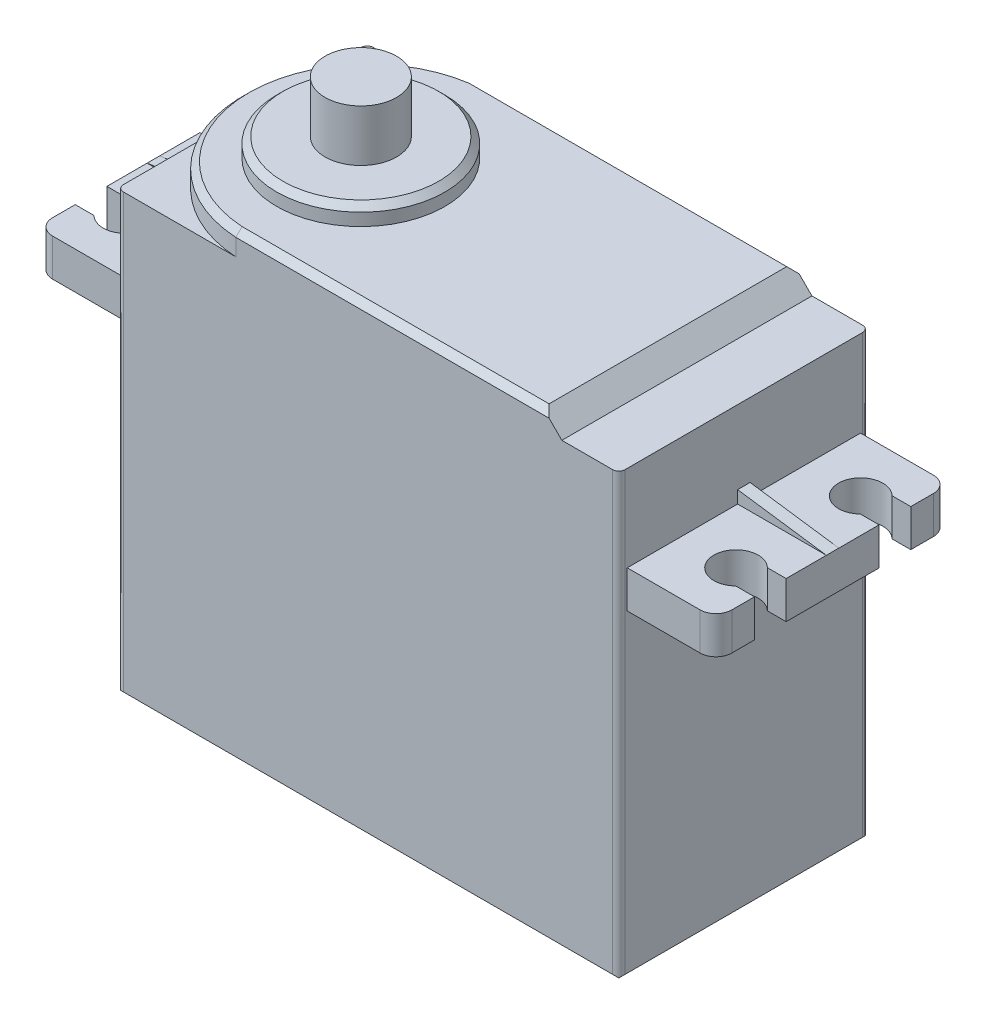
from build123d import *

# Parameters (mm, degrees)
SKETCH1_W           = 40.259
SKETCH1_H           = 20.066
BOSS_EXTRUDE1_DEPTH = 38.1
SKETCH2_W           = 54.5
SKETCH2_H           = 18.7198
BOSS_EXTRUDE2_DEPTH = 2.9972
SKETCH3_R           = 2.8702
BOSS_EXTRUDE3_DEPTH = 5.6388
SKETCH4_R           = 1.778
CUT_EXTRUDE1_DEPTH  = 42.513447759
SKETCH5_W           = 7.62
SKETCH5_H           = 2.54
SKETCH5_W_2         = 6.35
CUT_EXTRUDE2_DEPTH  = 42.513447759
FILLET2_R           = 1.27
SKETCH6_W           = 7.239
SKETCH6_H           = 4.318
BOSS_EXTRUDE4_DEPTH = 5.08
BOSS_EXTRUDE4_TAPER = 5
SKETCH7_W           = 4.572
SKETCH7_H           = 20.066
CUT_EXTRUDE3_DEPTH  = 1.524
CHAMFER1_SIZE       = 1.524
CUT_EXTRUDE4_DEPTH  = 1.8542
SKETCH9_R           = 6.75
BOSS_EXTRUDE5_DEPTH = 1.5
CHAMFER2_SIZE       = 0.5
CHAMFER3_SIZE       = 1.5
FILLET3_R           = 0.5
BOSS_EXTRUDE6_DEPTH = 0.5
FILLET4_R           = 1


with BuildPart() as part:
    # Sketch1 → Boss-Extrude1 (new body)
    with BuildSketch(Plane(origin=(0, 0, 0), x_dir=(1, 0, 0), z_dir=(0, 1, 0))):
        Rectangle(SKETCH1_W, SKETCH1_H)
    extrude(amount=BOSS_EXTRUDE1_DEPTH)

    # Sketch2 → Boss-Extrude2 (add)
    with BuildSketch(Plane(origin=(0, 26.67, 0), x_dir=(-1, 0, 0), z_dir=(0, -1, 0))):
        Rectangle(SKETCH2_W, SKETCH2_H)
    extrude(amount=-BOSS_EXTRUDE2_DEPTH)

    # Sketch3 → Boss-Extrude3 (add)
    with BuildSketch(Plane(origin=(0, 38.1, 0), x_dir=(1, 0, 0), z_dir=(0, 1, 0))):
        with Locations(Location((-10.6045, 0, 0), (0, 0, 90))):
            Circle(SKETCH3_R)
    extrude(amount=BOSS_EXTRUDE3_DEPTH)

    # Sketch4 → Cut-Extrude1 (cut, through all)
    with BuildSketch(Plane(origin=(0, 29.6672, 0), x_dir=(1, 0, 0), z_dir=(0, 1, 0))):
        with Locations(Location((-24.5, 5, 0), (0, 0, 270))):
            Circle(SKETCH4_R)
        with Locations(Location((-24.5, -5, 0), (0, 0, 270))):
            Circle(SKETCH4_R)
        with Locations(Location((24.5, -5, 0), (0, 0, 270))):
            Circle(SKETCH4_R)
        with Locations(Location((24.5, 5, 0), (0, 0, 270))):
            Circle(SKETCH4_R)
    extrude(amount=-CUT_EXTRUDE1_DEPTH, mode=Mode.SUBTRACT)

    # Sketch5 → Cut-Extrude2 (cut, through all)
    with BuildSketch(Plane(origin=(0, 29.6672, 0), x_dir=(1, 0, 0), z_dir=(0, 1, 0))):
        with Locations((-28.31, 5)):
            Rectangle(SKETCH5_W, SKETCH5_H)
        with Locations((-27.675, -5)):
            Rectangle(SKETCH5_W_2, SKETCH5_H)
        with Locations((27.675, 5)):
            Rectangle(SKETCH5_W_2, SKETCH5_H)
        with Locations((27.675, -5)):
            Rectangle(SKETCH5_W_2, SKETCH5_H)
    extrude(amount=-CUT_EXTRUDE2_DEPTH, mode=Mode.SUBTRACT)

    # Fillet2
    fillet2_edges = [part.edges().sort_by_distance(p)[0] for p in [
        (27.25, 28.1686, -9.3599),
        (-27.25, 28.1686, 9.3599),
        (27.25, 28.1686, 9.3599),
        (-27.25, 28.1686, -9.3599),
    ]]
    fillet(fillet2_edges, radius=FILLET2_R)

    # Sketch6 → Boss-Extrude4 (add)
    with BuildSketch(Plane.ZY.offset(20.1295)):
        with Locations((0, 5.715)):
            Rectangle(SKETCH6_W, SKETCH6_H)
    extrude(amount=BOSS_EXTRUDE4_DEPTH, taper=BOSS_EXTRUDE4_TAPER)

    # Sketch7 → Cut-Extrude3 (cut)
    with BuildSketch(Plane(origin=(0, 38.1, 0), x_dir=(1, 0, 0), z_dir=(0, 1, 0))):
        with Locations((17.8435, 0)):
            Rectangle(SKETCH7_W, SKETCH7_H)
    extrude(amount=-CUT_EXTRUDE3_DEPTH, mode=Mode.SUBTRACT)

    # Chamfer1
    chamfer1_edges = [part.edges().sort_by_distance(p)[0] for p in [
        (15.5575, 38.1, 0),
    ]]
    chamfer(chamfer1_edges, length=CHAMFER1_SIZE - 0.0001)  # a hair under: the kernel refuses the full size

    # Sketch8 → Cut-Extrude4 (cut)
    with BuildSketch(Plane(origin=(0, 38.1, 0), x_dir=(1, 0, 0), z_dir=(0, 1, 0))):
        with BuildLine():
            Line((-10.6045, 10.121534413), (-31.431367674, 17.812165279))
            Line((-31.431367674, 17.812165279), (-23.526690426, -15.868179363))
            Line((-23.526690426, -15.868179363), (-10.6045, -10.033))
            ThreePointArc((-10.6045, -10.033), (-20.1295, 0.044267206), (-10.6045, 10.121534413))
        make_face()
    extrude(amount=-CUT_EXTRUDE4_DEPTH, mode=Mode.SUBTRACT)

    # Sketch9 → Boss-Extrude5 (add)
    with BuildSketch(Plane(origin=(0, 38.1, 0), x_dir=(1, 0, 0), z_dir=(0, 1, 0))):
        with Locations(Location((-10.6045, 0, 0), (0, 0, 90))):
            Circle(SKETCH9_R)
    extrude(amount=BOSS_EXTRUDE5_DEPTH)

    # Chamfer2
    chamfer2_edges = [part.edges().sort_by_distance(p)[0] for p in [
        (1.274211255, 38.1, -10.033),
    ]]
    chamfer(chamfer2_edges, length=CHAMFER2_SIZE)
    chamfer2_2_edges = [part.edges().sort_by_distance(p)[0] for p in [
        (-20.022463004, 38.1, 1.421765307),
    ]]
    chamfer(chamfer2_2_edges, length=CHAMFER2_SIZE)
    chamfer2_3_edges = [part.edges().sort_by_distance(p)[0] for p in [
        (-10.6045, 39.6, 6.75),
    ]]
    chamfer(chamfer2_3_edges, length=CHAMFER2_SIZE)

    # Chamfer3
    chamfer3_edges = [part.edges().sort_by_distance(p)[0] for p in [
        (0, 0, 10.033),
        (-20.1295, 0, 0),
        (0, 0, -10.033),
        (20.1295, 0, 0),
    ]]
    chamfer(chamfer3_edges, length=CHAMFER3_SIZE)

    # Fillet3
    fillet3_edges = [part.edges().sort_by_distance(p)[0] for p in [
        (20.1295, 19.038, 10.033),
        (20.1295, 19.038, -10.033),
        (-20.1295, 18.8729, 10.033),
        (-20.1295, 18.8729, -10.033),
    ]]
    fillet(fillet3_edges, radius=FILLET3_R)

    # Sketch12 → Boss-Extrude6 (add, symmetric)
    with BuildSketch(Plane.XY):
        Polygon((-27.25, 29.6672), (-20.1295, 29.6672), (-20.1295, 30.6672), align=None)
    boss_extrude6 = extrude(amount=BOSS_EXTRUDE6_DEPTH, both=True)

    # Mirror1: Boss-Extrude6 across plane
    add(boss_extrude6.mirror(Plane(origin=(0, 0, 0), x_dir=(0, 0, 1), z_dir=(1, 0, 0))))

    # Fillet4
    fillet4_edges = [part.edges().sort_by_distance(p)[0] for p in [
        (-22.6695, 3.778221205, 3.397278795),
        (-22.6695, 7.651778795, 3.397278795),
        (-22.6695, 7.651778795, -3.397278795),
        (-22.6695, 3.778221205, -3.397278795),
        (-25.2095, 5.715, 3.175057589),
        (-25.2095, 7.429557589, 0),
        (-25.2095, 5.715, -3.175057589),
        (-25.2095, 4.000442411, 0),
    ]]
    fillet(fillet4_edges, radius=FILLET4_R)


solid = part.part
